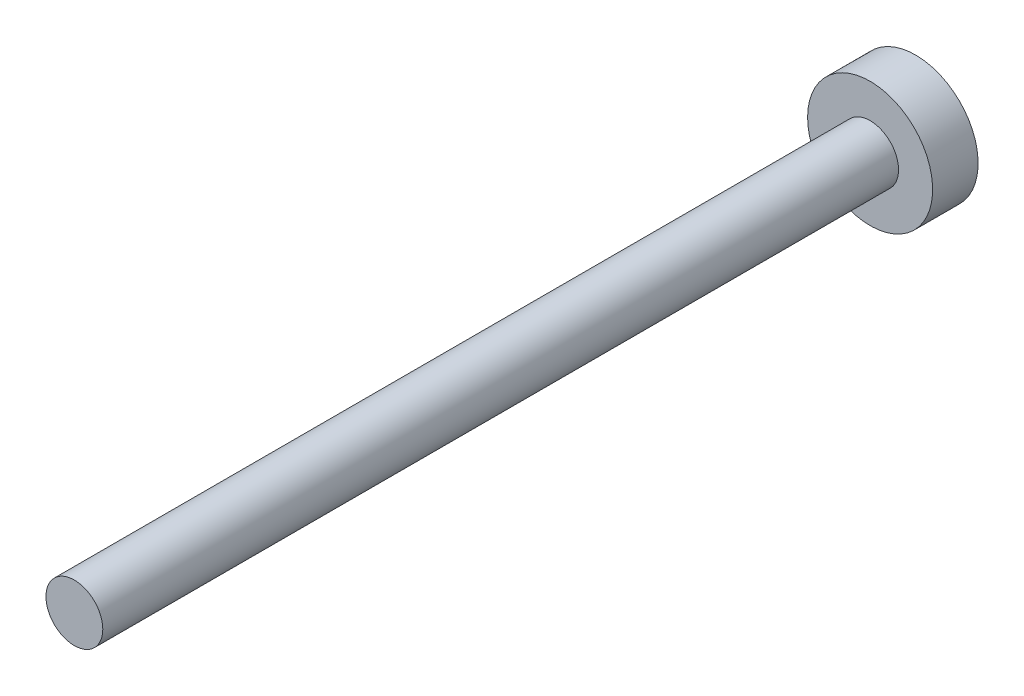
from build123d import *

# Parameters (mm, degrees)
SKETCH1_R           = 2.5
BOSS_EXTRUDE1_DEPTH = 35
SKETCH2_R           = 5.5
BOSS_EXTRUDE2_DEPTH = 4


with BuildPart() as part:
    # Sketch1 → Boss-Extrude1 (new, symmetric)
    with BuildSketch(Plane.XY):
        Circle(SKETCH1_R)
    extrude(amount=BOSS_EXTRUDE1_DEPTH, both=True)

    # Sketch2 → Boss-Extrude2 (add)
    with BuildSketch(Plane(origin=(0, 0, -35), x_dir=(-1, 0, 0), z_dir=(0, 0, -1))):
        Circle(SKETCH2_R)
    extrude(amount=BOSS_EXTRUDE2_DEPTH)


solid = part.part
